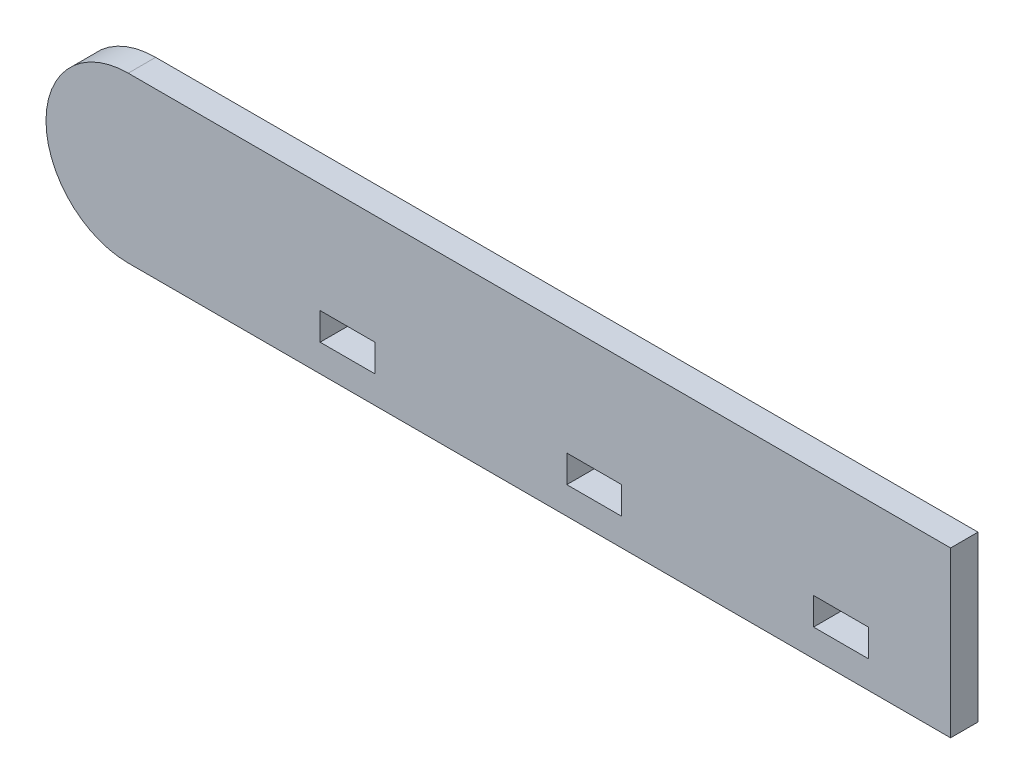
from build123d import *

# Parameters (mm, degrees)
ESQUISSE1_W        = 10
ESQUISSE1_H        = 5
BOSS_EXTRU_1_DEPTH = 5


with BuildPart() as part:
    # Esquisse1 → Boss.-Extru.1 (new body)
    with BuildSketch(Plane.XY):
        with BuildLine():
            Line((150, 15), (0, 15))
            ThreePointArc((0, 15), (-15, 0), (0, -15))
            Line((0, -15), (150, -15))
            Line((150, -15), (150, 15))
        make_face()
        with Locations((40, -7.5)):
            Rectangle(ESQUISSE1_W, ESQUISSE1_H, mode=Mode.SUBTRACT)
        with Locations((85, -7.5)):
            Rectangle(ESQUISSE1_W, ESQUISSE1_H, mode=Mode.SUBTRACT)
        with Locations((130, -7.5)):
            Rectangle(ESQUISSE1_W, ESQUISSE1_H, mode=Mode.SUBTRACT)
    extrude(amount=BOSS_EXTRU_1_DEPTH)


solid = part.part
